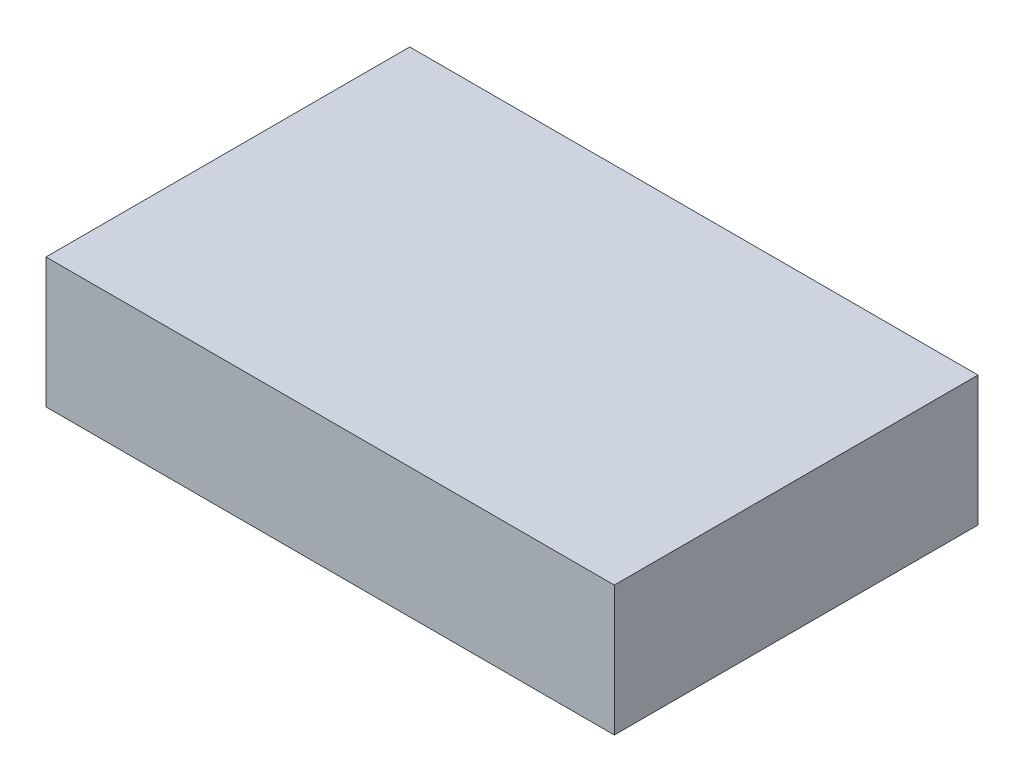
from build123d import *

# Parameters (mm, degrees)
SKETCH1_W           = 175
SKETCH1_H           = 112
BOSS_EXTRUDE1_DEPTH = 20


with BuildPart() as part:
    # Sketch1 → Boss-Extrude1 (new, symmetric)
    with BuildSketch(Plane(origin=(0, 0, 0), x_dir=(1, 0, 0), z_dir=(0, 1, 0))):
        Rectangle(SKETCH1_W, SKETCH1_H)
    extrude(amount=BOSS_EXTRUDE1_DEPTH, both=True)


solid = part.part
